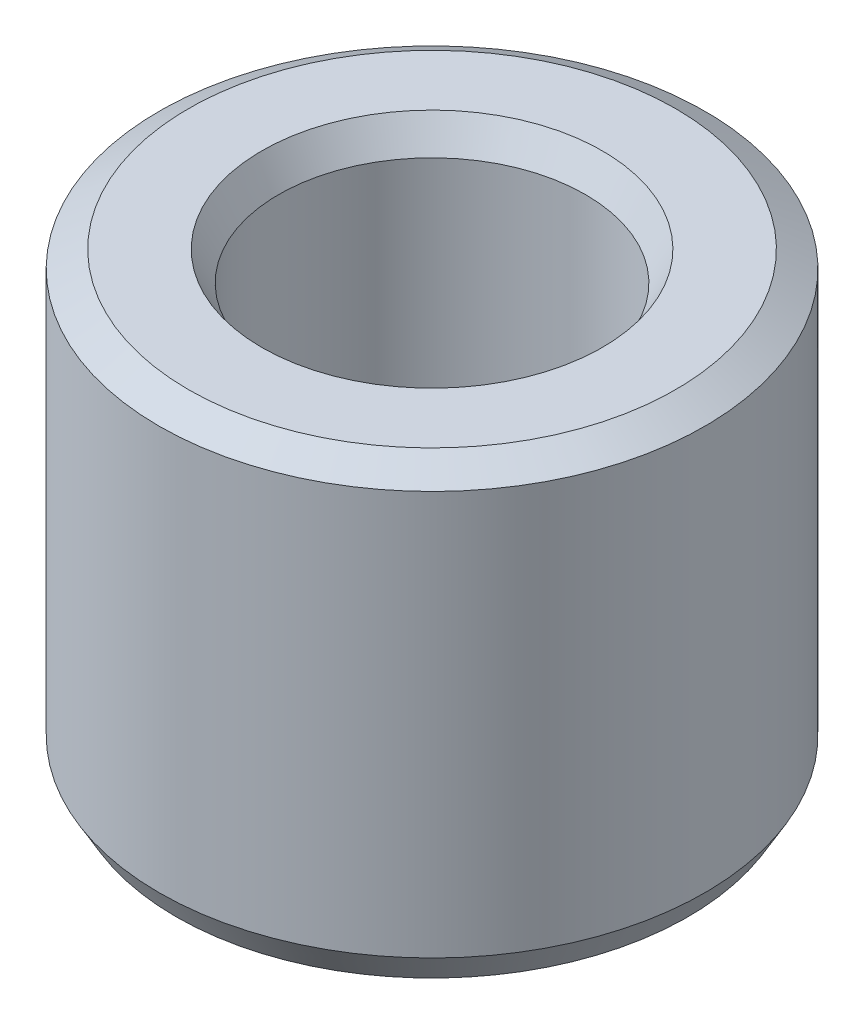
from build123d import *
from OCP.BRepFilletAPI import BRepFilletAPI_MakeChamfer

# Parameters (mm, degrees)
SKETCH1_R           = 47.5
BOSS_EXTRUDE1_DEPTH = 78.397395205
SKETCH2_R           = 26.699551962
CUT_EXTRUDE1_DEPTH  = 104.240745711
CHAMFER1_SIZE       = 2.950635172
CHAMFER1_SIZE2      = 5.110650033


with BuildPart() as part:
    # Sketch1 → Boss-Extrude1 (new body)
    with BuildSketch(Plane(origin=(0, 0, 0), x_dir=(1, 0, 0), z_dir=(0, 1, 0))):
        Circle(SKETCH1_R)
    extrude(amount=BOSS_EXTRUDE1_DEPTH)

    # Sketch2 → Cut-Extrude1 (cut, through all)
    with BuildSketch(Plane(origin=(0, 0, 0), x_dir=(1, 0, 0), z_dir=(0, 1, 0))):
        Circle(SKETCH2_R)
    extrude(amount=CUT_EXTRUDE1_DEPTH, mode=Mode.SUBTRACT)

    # Chamfer1: one chamfer whose edges measure the first distance from different faces: ONE call of the kernel's chamfer builder (chamfer() names one face for all edges)
    chamfer1_edges_1 = [part.edges().sort_by_distance(p)[0] for p in [
        (-26.699551962, 78.397395205, 0),
    ]]
    chamfer1_side_1 = [part.faces().sort_by_distance(p)[0] for p in [
        (-46.156497116, 78.397395205, 0),
    ]]
    chamfer1_edges_2 = [part.edges().sort_by_distance(p)[0] for p in [
        (-26.699551962, 0, 0),
    ]]
    chamfer1_side_2 = [part.faces().sort_by_distance(p)[0] for p in [
        (-26.699551962, 39.198697602, 0),
    ]]
    chamfer1_edges_3 = [part.edges().sort_by_distance(p)[0] for p in [
        (-47.5, 0, 0),
    ]]
    chamfer1_side_3 = [part.faces().sort_by_distance(p)[0] for p in [
        (-46.156497116, 0, 0),
    ]]
    chamfer1_edges_4 = [part.edges().sort_by_distance(p)[0] for p in [
        (-47.5, 78.397395205, 0),
    ]]
    chamfer1_side_4 = [part.faces().sort_by_distance(p)[0] for p in [
        (-47.5, 39.198697602, 0),
    ]]
    chamfer1 = BRepFilletAPI_MakeChamfer(part.part.solid().wrapped)
    for e in chamfer1_edges_1:
        chamfer1.Add(CHAMFER1_SIZE, CHAMFER1_SIZE2, e.wrapped, chamfer1_side_1[0].wrapped)  # the first distance lies on this face
    for e in chamfer1_edges_2:
        chamfer1.Add(CHAMFER1_SIZE, CHAMFER1_SIZE2, e.wrapped, chamfer1_side_2[0].wrapped)  # the first distance lies on this face
    for e in chamfer1_edges_3:
        chamfer1.Add(CHAMFER1_SIZE, CHAMFER1_SIZE2, e.wrapped, chamfer1_side_3[0].wrapped)  # the first distance lies on this face
    for e in chamfer1_edges_4:
        chamfer1.Add(CHAMFER1_SIZE, CHAMFER1_SIZE2, e.wrapped, chamfer1_side_4[0].wrapped)  # the first distance lies on this face
    add(Compound.cast(chamfer1.Shape()), mode=Mode.REPLACE)


solid = part.part
